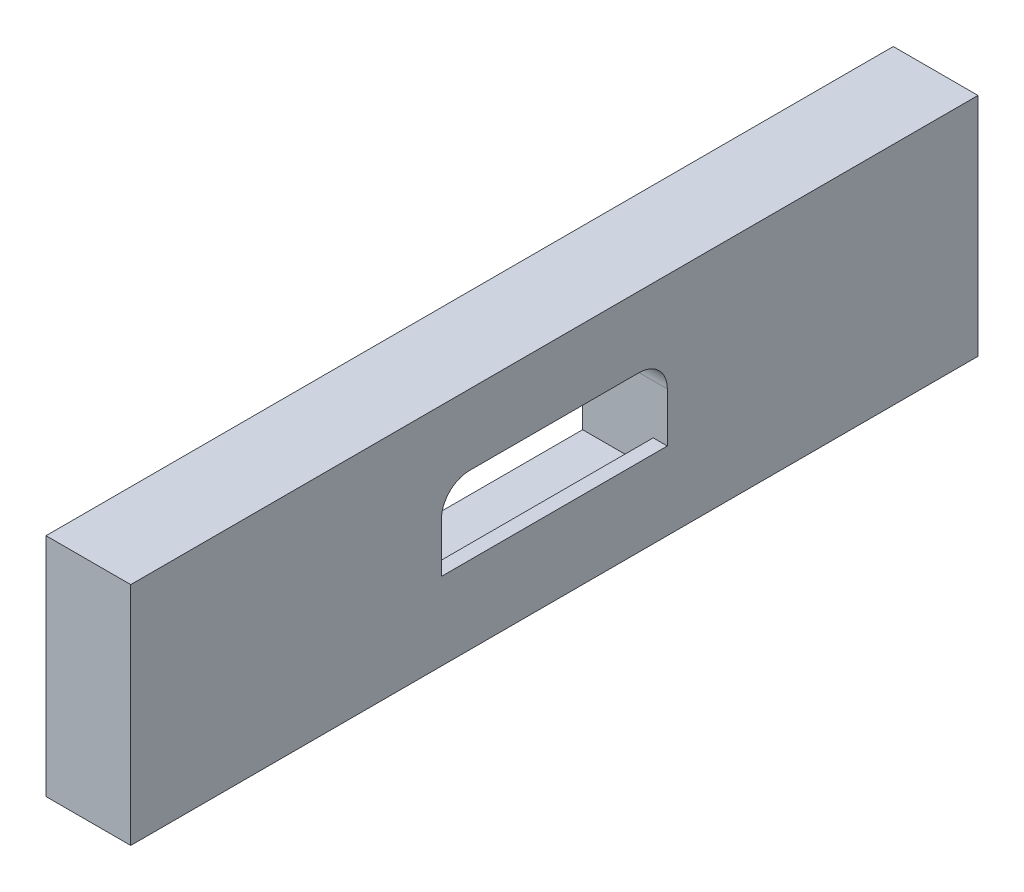
from build123d import *

# Parameters (mm, degrees)
SKETCH1_W           = 762
SKETCH1_H           = 203.2
BOSS_EXTRUDE1_DEPTH = 76.2
SKETCH2_W           = 203.2
SKETCH2_H           = 95.25
CUT_EXTRUDE1_DEPTH  = 63.5
SKETCH3_W           = 203.2
SKETCH3_H           = 69.85
CUT_EXTRUDE2_DEPTH  = 792.18044086
FILLET1_R           = 25.4


with BuildPart() as part:
    # Sketch1 → Boss-Extrude1 (new body)
    with BuildSketch(Plane(origin=(0, 0, 0), x_dir=(0, 0, -1), z_dir=(1, 0, 0))):
        with Locations((381, 101.6)):
            Rectangle(SKETCH1_W, SKETCH1_H)
    extrude(amount=BOSS_EXTRUDE1_DEPTH)

    # Sketch2 → Cut-Extrude1 (cut)
    with BuildSketch(Plane.ZY):
        with Locations((-381, 92.075)):
            Rectangle(SKETCH2_W, SKETCH2_H)
    extrude(amount=-CUT_EXTRUDE1_DEPTH, mode=Mode.SUBTRACT)

    # Sketch3 → Cut-Extrude2 (cut, through all)
    with BuildSketch(Plane.ZY.offset(-63.5)):
        with Locations((-381, 104.775)):
            Rectangle(SKETCH3_W, SKETCH3_H)
    extrude(amount=-CUT_EXTRUDE2_DEPTH, mode=Mode.SUBTRACT)

    # Fillet1
    fillet1_edges = [part.edges().sort_by_distance(p)[0] for p in [
        (38.1, 139.7, -279.4),
        (38.1, 139.7, -482.6),
    ]]
    fillet(fillet1_edges, radius=FILLET1_R)


solid = part.part
